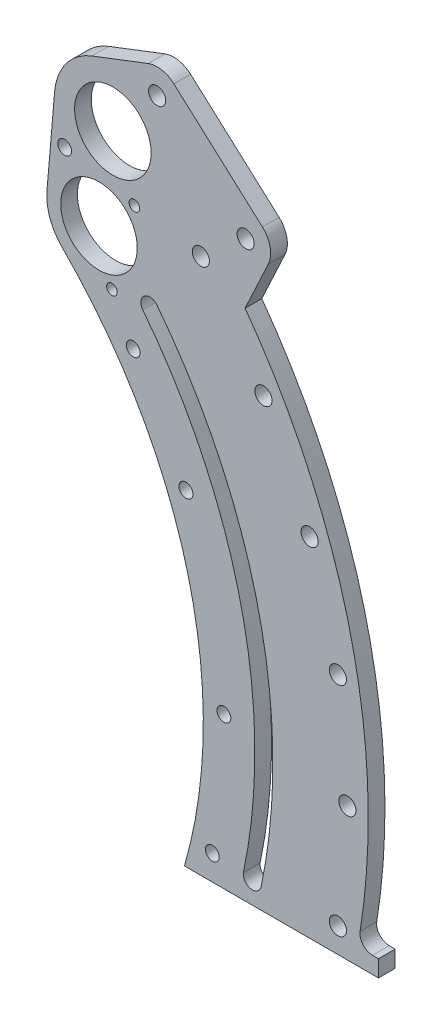
from build123d import *

# Parameters (mm, degrees)
SKETCH1_R           = 2.6289
SKETCH1_R_2         = 3.2639
SKETCH1_R_3         = 2.667
BOSS_EXTRUDE1_DEPTH = 6.35
BOSS_EXTRUDE2_START = -6.35
SKETCH3_R           = 14.5542
SKETCH3_R_2         = 3.2639
SKETCH3_R_3         = 2.6289
BOSS_EXTRUDE2_DEPTH = 6.35
SKETCH4_R           = 14.5542
SKETCH4_R_2         = 2.0193
CUT_EXTRUDE1_DEPTH  = 322.716169041
BOSS_EXTRUDE3_START = -6.35
BOSS_EXTRUDE3_DEPTH = 6.35
FILLET1_R           = 4.7625


with BuildPart() as part:
    # Sketch1 → Boss-Extrude1 (new body)
    with BuildSketch(Plane.XY):
        with BuildLine():
            ThreePointArc((183.35625, 0), (181.552952325, -25.652288715), (176.178529946, -50.8))
            Line((176.178529946, -50.8), (240.761529124, -50.8))
            ThreePointArc((240.761529124, -50.8), (235.877364624, 70.061564101), (173.992462346, 173.992462346))
            Line((173.992462346, 173.992462346), (129.652447748, 129.652447748))
            ThreePointArc((129.652447748, 129.652447748), (169.399086533, 70.167399096), (183.35625, 0))
        make_face()
        with Locations((186.787775735, -41.275)):
            Circle(SKETCH1_R, mode=Mode.SUBTRACT)
        with BuildLine():
            ThreePointArc((198.61336608, -41.711026485), (201.859935486, -20.967721902), (202.946, 0))
            ThreePointArc((202.946, 0), (191.993196693, 65.769988136), (160.317011605, 124.440888401))
            ThreePointArc((160.317011605, 124.440888401), (160.923178893, 129.252192093), (165.734482585, 128.646024805))
            ThreePointArc((165.734482585, 128.646024805), (198.481076932, 67.99250338), (209.804, 0))
            ThreePointArc((209.804, 0), (208.692287116, -21.569601625), (205.368929989, -42.910616532))
            ThreePointArc((205.368929989, -42.910616532), (201.391341659, -45.688667392), (198.61336608, -41.711026485))
        make_face(mode=Mode.SUBTRACT)
        with Locations((234.507346186, -41.349972307)):
            Circle(SKETCH1_R_2, mode=Mode.SUBTRACT)
        with Locations((238.125, 0)):
            Circle(SKETCH1_R_2, mode=Mode.SUBTRACT)
        with Locations((191.177219016, 6.676055597)):
            Circle(SKETCH1_R, mode=Mode.SUBTRACT)
        with Locations((234.507346186, 41.349972307)):
            Circle(SKETCH1_R_2, mode=Mode.SUBTRACT)
        with Locations((156.698666372, 109.721587421)):
            Circle(SKETCH1_R, mode=Mode.SUBTRACT)
        with Locations((176.732380322, 73.20494884)):
            Circle(SKETCH1_R_3, mode=Mode.SUBTRACT)
        with Locations((182.414333018, 153.063799557)):
            Circle(SKETCH1_R_2, mode=Mode.SUBTRACT)
        with Locations((223.764305325, 81.443546629)):
            Circle(SKETCH1_R_2, mode=Mode.SUBTRACT)
        with Locations((206.222299276, 119.0625)):
            Circle(SKETCH1_R_2, mode=Mode.SUBTRACT)
    extrude(amount=BOSS_EXTRUDE1_DEPTH)

    # Sketch3 → Boss-Extrude2 (add)
    with BuildSketch(Plane.XY.offset(6.35).offset(BOSS_EXTRUDE2_START)):
        with BuildLine():
            Line((129.652447748, 129.652447748), (161.644610179, 161.644610179))
            Line((161.644610179, 161.644610179), (173.992462346, 173.992462346))
            ThreePointArc((173.992462346, 173.992462346), (187.203995727, 159.691633751), (199.243521921, 144.391041546))
            Line((199.243521921, 144.391041546), (208.072252438, 163.324315239))
            ThreePointArc((208.072252438, 163.324315239), (208.773335867, 169.249312232), (205.812262342, 174.428998606))
            Line((205.812262342, 174.428998606), (172.171515343, 204.711713553))
            ThreePointArc((172.171515343, 204.711713553), (167.533866317, 206.998129776), (162.384955615, 206.524625586))
            Line((162.384955615, 206.524625586), (140.998030433, 198.31353733))
            ThreePointArc((140.998030433, 198.31353733), (131.199359749, 190.920685757), (126.819367879, 179.454044017))
            Line((126.819367879, 179.454044017), (123.912144148, 145.370590574))
            ThreePointArc((123.912144148, 145.370590574), (125.044465056, 136.876859135), (129.652447748, 129.652447748))
        make_face()
        with Locations((148.963956123, 177.565172264)):
            Circle(SKETCH3_R, mode=Mode.SUBTRACT)
        with Locations((199.439670766, 167.349754182)):
            Circle(SKETCH3_R_2, mode=Mode.SUBTRACT)
        with Locations((165.798923767, 197.632469129)):
            Circle(SKETCH3_R_2, mode=Mode.SUBTRACT)
        with Locations((130.638344472, 163.06901389)):
            Circle(SKETCH3_R_3, mode=Mode.SUBTRACT)
    extrude(amount=BOSS_EXTRUDE2_DEPTH)

    # Sketch4 → Cut-Extrude1 (cut, through all)
    with BuildSketch(Plane.XY.offset(6.35)):
        with Locations((143.684097937, 143.684097937)):
            Circle(SKETCH4_R)
        with Locations((157.154482119, 157.154482119)):
            Circle(SKETCH4_R_2)
        with Locations((148.614600746, 125.283210946)):
            Circle(SKETCH4_R_2)
    extrude(amount=-CUT_EXTRUDE1_DEPTH, mode=Mode.SUBTRACT)

    # Sketch5 → Boss-Extrude3 (add)
    with BuildSketch(Plane.XY.offset(6.35).offset(BOSS_EXTRUDE3_START)):
        with BuildLine():
            Line((240.761529124, -50.8), (249.951861983, -50.8))
            Line((249.951861983, -50.8), (249.951861983, -44.45))
            Line((249.951861983, -44.45), (242.014361983, -44.45))
            ThreePointArc((242.014361983, -44.45), (241.408825198, -47.629119481), (240.761529124, -50.8))
        make_face()
    extrude(amount=BOSS_EXTRUDE3_DEPTH)

    # Fillet1
    fillet1_edges = [part.edges().sort_by_distance(p)[0] for p in [
        (242.014361983, -44.45, 3.175),
    ]]
    fillet(fillet1_edges, radius=FILLET1_R)


solid = part.part
